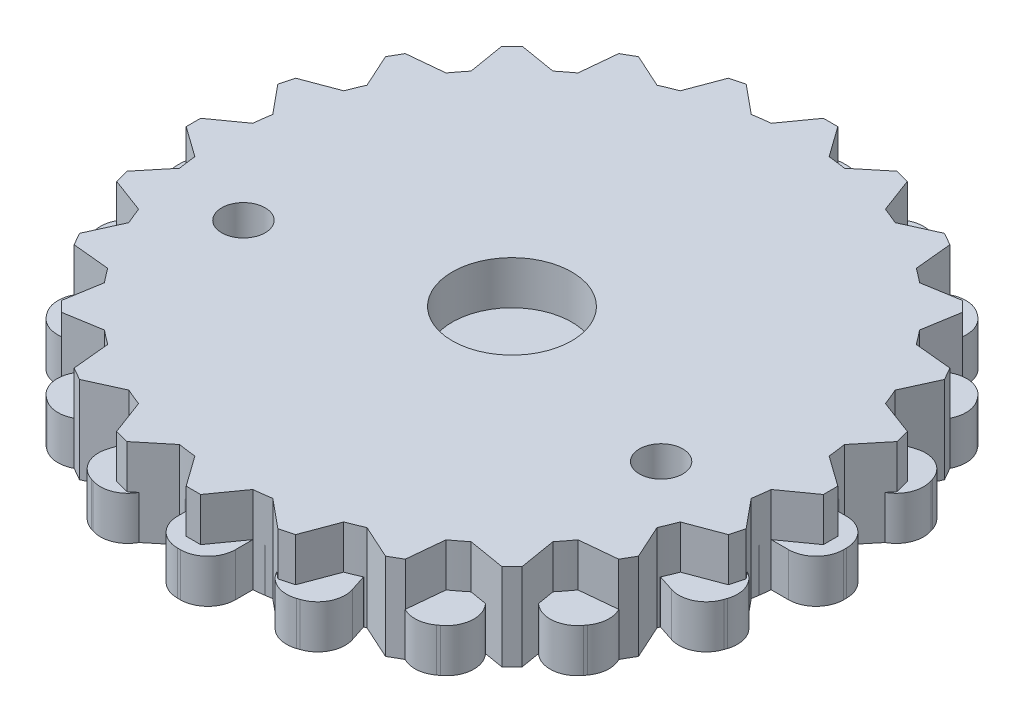
from build123d import *

# Parameters (mm, degrees)
BOSS_EXTRUDE3_DEPTH = 3
BOSS_EXTRUDE5_DEPTH = 6
BOSS_EXTRUDE6_DEPTH = 3
SKETCH4_R           = 4.125
CUT_EXTRUDE1_DEPTH  = 10
SKETCH5_R           = 1.5
CUT_EXTRUDE2_DEPTH  = 34.075670817


with BuildPart() as part:
    # Sketch2 → Boss-Extrude3 (new body)
    with BuildSketch(Plane(origin=(0, 0, 0), x_dir=(1, 0, 0), z_dir=(0, 1, 0))):
        with BuildLine():
            Line((-23, 0.1), (-23, -0.1))
            ThreePointArc((-23, -0.1), (-22.443502884, -1.443502884), (-21.1, -2))
            Line((-21.1, -2), (-19.899748742, -2))
            ThreePointArc((-19.899748742, -2), (-19.753766812, -3.128689301), (-19.543819703, -4.247247513))
            Line((-19.543819703, -4.247247513), (-20.685326483, -4.618145549))
            ThreePointArc((-20.685326483, -4.618145549), (-21.791106589, -5.56257098), (-21.905201574, -7.012285219))
            Line((-21.905201574, -7.012285219), (-21.843398175, -7.202496522))
            ThreePointArc((-21.843398175, -7.202496522), (-20.898972744, -8.308276629), (-19.449258505, -8.422371614))
            Line((-19.449258505, -8.422371614), (-18.307751725, -8.051473578))
            ThreePointArc((-18.307751725, -8.051473578), (-17.820130484, -9.079809995), (-17.274805421, -10.078744846))
            Line((-17.274805421, -10.078744846), (-18.245829086, -10.784234835))
            ThreePointArc((-18.245829086, -10.784234835), (-19.005644954, -12.02414164), (-18.666169396, -13.438159103))
            Line((-18.666169396, -13.438159103), (-18.548612345, -13.599962502))
            ThreePointArc((-18.548612345, -13.599962502), (-17.30870554, -14.35977837), (-15.894688077, -14.020302812))
            Line((-15.894688077, -14.020302812), (-14.923664412, -13.314812824))
            ThreePointArc((-14.923664412, -13.314812824), (-14.142135624, -14.142135624), (-13.314812824, -14.923664412))
            Line((-13.314812824, -14.923664412), (-14.020302812, -15.894688077))
            ThreePointArc((-14.020302812, -15.894688077), (-14.35977837, -17.30870554), (-13.599962502, -18.548612345))
            Line((-13.599962502, -18.548612345), (-13.438159103, -18.666169396))
            ThreePointArc((-13.438159103, -18.666169396), (-12.02414164, -19.005644954), (-10.784234835, -18.245829086))
            Line((-10.784234835, -18.245829086), (-10.078744846, -17.274805421))
            ThreePointArc((-10.078744846, -17.274805421), (-9.079809995, -17.820130484), (-8.051473578, -18.307751725))
            Line((-8.051473578, -18.307751725), (-8.422371614, -19.449258505))
            ThreePointArc((-8.422371614, -19.449258505), (-8.308276629, -20.898972744), (-7.202496522, -21.843398175))
            Line((-7.202496522, -21.843398175), (-7.012285219, -21.905201574))
            ThreePointArc((-7.012285219, -21.905201574), (-5.56257098, -21.791106589), (-4.618145549, -20.685326483))
            Line((-4.618145549, -20.685326483), (-4.247247513, -19.543819703))
            ThreePointArc((-4.247247513, -19.543819703), (-3.128689301, -19.753766812), (-2, -19.899748742))
            Line((-2, -19.899748742), (-2, -21.1))
            ThreePointArc((-2, -21.1), (-1.443502884, -22.443502884), (-0.1, -23))
            Line((-0.1, -23), (0.1, -23))
            ThreePointArc((0.1, -23), (1.443502884, -22.443502884), (2, -21.1))
            Line((2, -21.1), (2, -19.899748742))
            ThreePointArc((2, -19.899748742), (3.128689301, -19.753766812), (4.247247513, -19.543819703))
            Line((4.247247513, -19.543819703), (4.618145549, -20.685326483))
            ThreePointArc((4.618145549, -20.685326483), (5.56257098, -21.791106589), (7.012285219, -21.905201574))
            Line((7.012285219, -21.905201574), (7.202496522, -21.843398175))
            ThreePointArc((7.202496522, -21.843398175), (8.308276629, -20.898972744), (8.422371614, -19.449258505))
            Line((8.422371614, -19.449258505), (8.051473578, -18.307751725))
            ThreePointArc((8.051473578, -18.307751725), (9.079809995, -17.820130484), (10.078744846, -17.274805421))
            Line((10.078744846, -17.274805421), (10.784234835, -18.245829086))
            ThreePointArc((10.784234835, -18.245829086), (12.02414164, -19.005644954), (13.438159103, -18.666169396))
            Line((13.438159103, -18.666169396), (13.599962502, -18.548612345))
            ThreePointArc((13.599962502, -18.548612345), (14.35977837, -17.30870554), (14.020302812, -15.894688077))
            Line((14.020302812, -15.894688077), (13.314812824, -14.923664412))
            ThreePointArc((13.314812824, -14.923664412), (14.142135624, -14.142135624), (14.923664412, -13.314812824))
            Line((14.923664412, -13.314812824), (15.894688077, -14.020302812))
            ThreePointArc((15.894688077, -14.020302812), (17.30870554, -14.35977837), (18.548612345, -13.599962502))
            Line((18.548612345, -13.599962502), (18.666169396, -13.438159103))
            ThreePointArc((18.666169396, -13.438159103), (19.005644954, -12.02414164), (18.245829086, -10.784234835))
            Line((18.245829086, -10.784234835), (17.274805421, -10.078744846))
            ThreePointArc((17.274805421, -10.078744846), (17.820130484, -9.079809995), (18.307751725, -8.051473578))
            Line((18.307751725, -8.051473578), (19.449258505, -8.422371614))
            ThreePointArc((19.449258505, -8.422371614), (20.898972744, -8.308276629), (21.843398175, -7.202496522))
            Line((21.843398175, -7.202496522), (21.905201574, -7.012285219))
            ThreePointArc((21.905201574, -7.012285219), (21.791106589, -5.56257098), (20.685326483, -4.618145549))
            Line((20.685326483, -4.618145549), (19.543819703, -4.247247513))
            ThreePointArc((19.543819703, -4.247247513), (19.753766812, -3.128689301), (19.899748742, -2))
            Line((19.899748742, -2), (21.1, -2))
            ThreePointArc((21.1, -2), (22.443502884, -1.443502884), (23, -0.1))
            Line((23, -0.1), (23, 0.1))
            ThreePointArc((23, 0.1), (22.443502884, 1.443502884), (21.1, 2))
            Line((21.1, 2), (19.899748742, 2))
            ThreePointArc((19.899748742, 2), (19.753766812, 3.128689301), (19.543819703, 4.247247513))
            Line((19.543819703, 4.247247513), (20.685326483, 4.618145549))
            ThreePointArc((20.685326483, 4.618145549), (21.791106589, 5.56257098), (21.905201574, 7.012285219))
            Line((21.905201574, 7.012285219), (21.843398175, 7.202496522))
            ThreePointArc((21.843398175, 7.202496522), (20.898972744, 8.308276629), (19.449258505, 8.422371614))
            Line((19.449258505, 8.422371614), (18.307751725, 8.051473578))
            ThreePointArc((18.307751725, 8.051473578), (17.820130484, 9.079809995), (17.274805421, 10.078744846))
            Line((17.274805421, 10.078744846), (18.245829086, 10.784234835))
            ThreePointArc((18.245829086, 10.784234835), (19.005644954, 12.02414164), (18.666169396, 13.438159103))
            Line((18.666169396, 13.438159103), (18.548612345, 13.599962502))
            ThreePointArc((18.548612345, 13.599962502), (17.30870554, 14.35977837), (15.894688077, 14.020302812))
            Line((15.894688077, 14.020302812), (14.923664412, 13.314812824))
            ThreePointArc((14.923664412, 13.314812824), (14.142135624, 14.142135624), (13.314812824, 14.923664412))
            Line((13.314812824, 14.923664412), (14.020302812, 15.894688077))
            ThreePointArc((14.020302812, 15.894688077), (14.35977837, 17.30870554), (13.599962502, 18.548612345))
            Line((13.599962502, 18.548612345), (13.438159103, 18.666169396))
            ThreePointArc((13.438159103, 18.666169396), (12.02414164, 19.005644954), (10.784234835, 18.245829086))
            Line((10.784234835, 18.245829086), (10.078744846, 17.274805421))
            ThreePointArc((10.078744846, 17.274805421), (9.079809995, 17.820130484), (8.051473578, 18.307751725))
            Line((8.051473578, 18.307751725), (8.422371614, 19.449258505))
            ThreePointArc((8.422371614, 19.449258505), (8.308276629, 20.898972744), (7.202496522, 21.843398175))
            Line((7.202496522, 21.843398175), (7.012285219, 21.905201574))
            ThreePointArc((7.012285219, 21.905201574), (5.56257098, 21.791106589), (4.618145549, 20.685326483))
            Line((4.618145549, 20.685326483), (4.247247513, 19.543819703))
            ThreePointArc((4.247247513, 19.543819703), (3.128689301, 19.753766812), (2, 19.899748742))
            Line((2, 19.899748742), (2, 21.1))
            ThreePointArc((2, 21.1), (1.443502884, 22.443502884), (0.1, 23))
            Line((0.1, 23), (-0.1, 23))
            ThreePointArc((-0.1, 23), (-1.443502884, 22.443502884), (-2, 21.1))
            Line((-2, 21.1), (-2, 19.899748742))
            ThreePointArc((-2, 19.899748742), (-3.128689301, 19.753766812), (-4.247247513, 19.543819703))
            Line((-4.247247513, 19.543819703), (-4.618145549, 20.685326483))
            ThreePointArc((-4.618145549, 20.685326483), (-5.56257098, 21.791106589), (-7.012285219, 21.905201574))
            Line((-7.012285219, 21.905201574), (-7.202496522, 21.843398175))
            ThreePointArc((-7.202496522, 21.843398175), (-8.308276629, 20.898972744), (-8.422371614, 19.449258505))
            Line((-8.422371614, 19.449258505), (-8.051473578, 18.307751725))
            ThreePointArc((-8.051473578, 18.307751725), (-9.079809995, 17.820130484), (-10.078744846, 17.274805421))
            Line((-10.078744846, 17.274805421), (-10.784234835, 18.245829086))
            ThreePointArc((-10.784234835, 18.245829086), (-12.02414164, 19.005644954), (-13.438159103, 18.666169396))
            Line((-13.438159103, 18.666169396), (-13.599962502, 18.548612345))
            ThreePointArc((-13.599962502, 18.548612345), (-14.35977837, 17.30870554), (-14.020302812, 15.894688077))
            Line((-14.020302812, 15.894688077), (-13.314812824, 14.923664412))
            ThreePointArc((-13.314812824, 14.923664412), (-14.142135624, 14.142135624), (-14.923664412, 13.314812824))
            Line((-14.923664412, 13.314812824), (-15.894688077, 14.020302812))
            ThreePointArc((-15.894688077, 14.020302812), (-17.30870554, 14.35977837), (-18.548612345, 13.599962502))
            Line((-18.548612345, 13.599962502), (-18.666169396, 13.438159103))
            ThreePointArc((-18.666169396, 13.438159103), (-19.005644954, 12.02414164), (-18.245829086, 10.784234835))
            Line((-18.245829086, 10.784234835), (-17.274805421, 10.078744846))
            ThreePointArc((-17.274805421, 10.078744846), (-17.820130484, 9.079809995), (-18.307751725, 8.051473578))
            Line((-18.307751725, 8.051473578), (-19.449258505, 8.422371614))
            ThreePointArc((-19.449258505, 8.422371614), (-20.898972744, 8.308276629), (-21.843398175, 7.202496522))
            Line((-21.843398175, 7.202496522), (-21.905201574, 7.012285219))
            ThreePointArc((-21.905201574, 7.012285219), (-21.791106589, 5.56257098), (-20.685326483, 4.618145549))
            Line((-20.685326483, 4.618145549), (-19.543819703, 4.247247513))
            ThreePointArc((-19.543819703, 4.247247513), (-19.753766812, 3.128689301), (-19.899748742, 2))
            Line((-19.899748742, 2), (-21.1, 2))
            ThreePointArc((-21.1, 2), (-22.443502884, 1.443502884), (-23, 0.1))
        make_face()
    extrude(amount=BOSS_EXTRUDE3_DEPTH)


with BuildPart() as body_2:
    # Sketch3 → Boss-Extrude5 (new body)
    with BuildSketch(Plane(origin=(0, 0, 0), x_dir=(1, 0, 0), z_dir=(0, 1, 0))):
        with BuildLine():
            Line((-22, 0.5), (-22, -0.5))
            Line((-22, -0.5), (-19.899748742, -2))
            ThreePointArc((-19.899748742, -2), (-19.828897227, -2.610523844), (-19.739319337, -3.218582315))
            Line((-19.739319337, -3.218582315), (-21.379777701, -5.211056079))
            Line((-21.379777701, -5.211056079), (-21.120958656, -6.176981905))
            Line((-21.120958656, -6.176981905), (-18.704043156, -7.08228562))
            ThreePointArc((-18.704043156, -7.08228562), (-18.47759065, -7.653668647), (-18.23368794, -8.217823563))
            Line((-18.23368794, -8.217823563), (-19.302558883, -10.566987298))
            Line((-19.302558883, -10.566987298), (-18.802558883, -11.433012702))
            Line((-18.802558883, -11.433012702), (-16.23368794, -11.681925179))
            ThreePointArc((-16.23368794, -11.681925179), (-15.867066806, -12.17522858), (-15.485460842, -12.657033717))
            Line((-15.485460842, -12.657033717), (-15.909902577, -15.202795796))
            Line((-15.909902577, -15.202795796), (-15.202795796, -15.909902577))
            Line((-15.202795796, -15.909902577), (-12.657033717, -15.485460842))
            ThreePointArc((-12.657033717, -15.485460842), (-12.17522858, -15.867066806), (-11.681925179, -16.23368794))
            Line((-11.681925179, -16.23368794), (-11.433012702, -18.802558883))
            Line((-11.433012702, -18.802558883), (-10.566987298, -19.302558883))
            Line((-10.566987298, -19.302558883), (-8.217823563, -18.23368794))
            ThreePointArc((-8.217823563, -18.23368794), (-7.653668647, -18.47759065), (-7.08228562, -18.704043156))
            Line((-7.08228562, -18.704043156), (-6.176981905, -21.120958656))
            Line((-6.176981905, -21.120958656), (-5.211056079, -21.379777701))
            Line((-5.211056079, -21.379777701), (-3.218582315, -19.739319337))
            ThreePointArc((-3.218582315, -19.739319337), (-2.610523844, -19.828897227), (-2, -19.899748742))
            Line((-2, -19.899748742), (-0.5, -22))
            Line((-0.5, -22), (0.5, -22))
            Line((0.5, -22), (2, -19.899748742))
            ThreePointArc((2, -19.899748742), (2.610523844, -19.828897227), (3.218582315, -19.739319337))
            Line((3.218582315, -19.739319337), (5.211056079, -21.379777701))
            Line((5.211056079, -21.379777701), (6.176981905, -21.120958656))
            Line((6.176981905, -21.120958656), (7.08228562, -18.704043156))
            ThreePointArc((7.08228562, -18.704043156), (7.653668647, -18.47759065), (8.217823563, -18.23368794))
            Line((8.217823563, -18.23368794), (10.566987298, -19.302558883))
            Line((10.566987298, -19.302558883), (11.433012702, -18.802558883))
            Line((11.433012702, -18.802558883), (11.681925179, -16.23368794))
            ThreePointArc((11.681925179, -16.23368794), (12.17522858, -15.867066806), (12.657033717, -15.485460842))
            Line((12.657033717, -15.485460842), (15.202795796, -15.909902577))
            Line((15.202795796, -15.909902577), (15.909902577, -15.202795796))
            Line((15.909902577, -15.202795796), (15.485460842, -12.657033717))
            ThreePointArc((15.485460842, -12.657033717), (15.867066806, -12.17522858), (16.23368794, -11.681925179))
            Line((16.23368794, -11.681925179), (18.802558883, -11.433012702))
            Line((18.802558883, -11.433012702), (19.302558883, -10.566987298))
            Line((19.302558883, -10.566987298), (18.23368794, -8.217823563))
            ThreePointArc((18.23368794, -8.217823563), (18.47759065, -7.653668647), (18.704043156, -7.08228562))
            Line((18.704043156, -7.08228562), (21.120958656, -6.176981905))
            Line((21.120958656, -6.176981905), (21.379777701, -5.211056079))
            Line((21.379777701, -5.211056079), (19.739319337, -3.218582315))
            ThreePointArc((19.739319337, -3.218582315), (19.828897227, -2.610523844), (19.899748742, -2))
            Line((19.899748742, -2), (22, -0.5))
            Line((22, -0.5), (22, 0.5))
            Line((22, 0.5), (19.899748742, 2))
            ThreePointArc((19.899748742, 2), (19.828897227, 2.610523844), (19.739319337, 3.218582315))
            Line((19.739319337, 3.218582315), (21.379777701, 5.211056079))
            Line((21.379777701, 5.211056079), (21.120958656, 6.176981905))
            Line((21.120958656, 6.176981905), (18.704043156, 7.08228562))
            ThreePointArc((18.704043156, 7.08228562), (18.47759065, 7.653668647), (18.23368794, 8.217823563))
            Line((18.23368794, 8.217823563), (19.302558883, 10.566987298))
            Line((19.302558883, 10.566987298), (18.802558883, 11.433012702))
            Line((18.802558883, 11.433012702), (16.23368794, 11.681925179))
            ThreePointArc((16.23368794, 11.681925179), (15.867066806, 12.17522858), (15.485460842, 12.657033717))
            Line((15.485460842, 12.657033717), (15.909902577, 15.202795796))
            Line((15.909902577, 15.202795796), (15.202795796, 15.909902577))
            Line((15.202795796, 15.909902577), (12.657033717, 15.485460842))
            ThreePointArc((12.657033717, 15.485460842), (12.17522858, 15.867066806), (11.681925179, 16.23368794))
            Line((11.681925179, 16.23368794), (11.433012702, 18.802558883))
            Line((11.433012702, 18.802558883), (10.566987298, 19.302558883))
            Line((10.566987298, 19.302558883), (8.217823563, 18.23368794))
            ThreePointArc((8.217823563, 18.23368794), (7.653668647, 18.47759065), (7.08228562, 18.704043156))
            Line((7.08228562, 18.704043156), (6.176981905, 21.120958656))
            Line((6.176981905, 21.120958656), (5.211056079, 21.379777701))
            Line((5.211056079, 21.379777701), (3.218582315, 19.739319337))
            ThreePointArc((3.218582315, 19.739319337), (2.610523844, 19.828897227), (2, 19.899748742))
            Line((2, 19.899748742), (0.5, 22))
            Line((0.5, 22), (-0.5, 22))
            Line((-0.5, 22), (-2, 19.899748742))
            ThreePointArc((-2, 19.899748742), (-2.610523844, 19.828897227), (-3.218582315, 19.739319337))
            Line((-3.218582315, 19.739319337), (-5.211056079, 21.379777701))
            Line((-5.211056079, 21.379777701), (-6.176981905, 21.120958656))
            Line((-6.176981905, 21.120958656), (-7.08228562, 18.704043156))
            ThreePointArc((-7.08228562, 18.704043156), (-7.653668647, 18.47759065), (-8.217823563, 18.23368794))
            Line((-8.217823563, 18.23368794), (-10.566987298, 19.302558883))
            Line((-10.566987298, 19.302558883), (-11.433012702, 18.802558883))
            Line((-11.433012702, 18.802558883), (-11.681925179, 16.23368794))
            ThreePointArc((-11.681925179, 16.23368794), (-12.17522858, 15.867066806), (-12.657033717, 15.485460842))
            Line((-12.657033717, 15.485460842), (-15.202795796, 15.909902577))
            Line((-15.202795796, 15.909902577), (-15.909902577, 15.202795796))
            Line((-15.909902577, 15.202795796), (-15.485460842, 12.657033717))
            ThreePointArc((-15.485460842, 12.657033717), (-15.867066806, 12.17522858), (-16.23368794, 11.681925179))
            Line((-16.23368794, 11.681925179), (-18.802558883, 11.433012702))
            Line((-18.802558883, 11.433012702), (-19.302558883, 10.566987298))
            Line((-19.302558883, 10.566987298), (-18.23368794, 8.217823563))
            ThreePointArc((-18.23368794, 8.217823563), (-18.47759065, 7.653668647), (-18.704043156, 7.08228562))
            Line((-18.704043156, 7.08228562), (-21.120958656, 6.176981905))
            Line((-21.120958656, 6.176981905), (-21.379777701, 5.211056079))
            Line((-21.379777701, 5.211056079), (-19.739319337, 3.218582315))
            ThreePointArc((-19.739319337, 3.218582315), (-19.828897227, 2.610523844), (-19.899748742, 2))
            Line((-19.899748742, 2), (-22, 0.5))
        make_face()
    extrude(amount=BOSS_EXTRUDE5_DEPTH)

    # Sketch4 → Cut-Extrude1 (cut)
    with BuildSketch(Plane(origin=(0, 6, 0), x_dir=(1, 0, 0), z_dir=(0, 1, 0))):
        Circle(SKETCH4_R)
    extrude(amount=-CUT_EXTRUDE1_DEPTH, mode=Mode.SUBTRACT)

    # Sketch5 → Cut-Extrude2 (cut, through all)
    with BuildSketch(Plane(origin=(0, 6, 0), x_dir=(1, 0, 0), z_dir=(0, 1, 0))):
        with Locations((-14.421663392, -4.125)):
            Circle(SKETCH5_R)
        with Locations((14.421663392, -4.125)):
            Circle(SKETCH5_R)
    extrude(amount=-CUT_EXTRUDE2_DEPTH, mode=Mode.SUBTRACT)


with BuildPart() as body_3:
    # Sketch1 → Boss-Extrude6 (new body)
    with BuildSketch(Plane(origin=(0, 0, 0), x_dir=(1, 0, 0), z_dir=(0, 1, 0))):
        with BuildLine():
            Line((-0.5, 14.746169466), (0.5, 14.746169466))
            Line((0.5, 14.746169466), (2, 12.544128437))
            ThreePointArc((2, 12.544128437), (2.588190451, 12.405427729), (3.166928678, 12.23145084))
            Line((3.166928678, 12.23145084), (5.566987298, 13.388474311))
            Line((5.566987298, 13.388474311), (6.433012702, 12.888474311))
            Line((6.433012702, 12.888474311), (6.631030293, 10.23145084))
            ThreePointArc((6.631030293, 10.23145084), (7.071067812, 9.817237278), (7.485281374, 9.377199759))
            Line((7.485281374, 9.377199759), (10.142304845, 9.179182168))
            Line((10.142304845, 9.179182168), (10.642304845, 8.313156764))
            Line((10.642304845, 8.313156764), (9.485281374, 5.913098144))
            ThreePointArc((9.485281374, 5.913098144), (9.659258263, 5.334359917), (9.797958971, 4.746169466))
            Line((9.797958971, 4.746169466), (12, 3.246169466))
            Line((12, 3.246169466), (12, 2.246169466))
            Line((12, 2.246169466), (9.797958971, 0.746169466))
            ThreePointArc((9.797958971, 0.746169466), (9.659258263, 0.157979015), (9.485281374, -0.420759212))
            Line((9.485281374, -0.420759212), (10.642304845, -2.820817832))
            Line((10.642304845, -2.820817832), (10.142304845, -3.686843236))
            Line((10.142304845, -3.686843236), (7.485281374, -3.884860827))
            ThreePointArc((7.485281374, -3.884860827), (7.071067812, -4.324898346), (6.631030293, -4.739111908))
            Line((6.631030293, -4.739111908), (6.433012702, -7.39613538))
            Line((6.433012702, -7.39613538), (5.566987298, -7.89613538))
            Line((5.566987298, -7.89613538), (3.166928678, -6.739111908))
            ThreePointArc((3.166928678, -6.739111908), (2.588190451, -6.913088797), (2, -7.051789505))
            Line((2, -7.051789505), (0.5, -9.253830534))
            Line((0.5, -9.253830534), (-0.5, -9.253830534))
            Line((-0.5, -9.253830534), (-2, -7.051789505))
            ThreePointArc((-2, -7.051789505), (-2.588190451, -6.913088797), (-3.166928678, -6.739111908))
            Line((-3.166928678, -6.739111908), (-5.566987298, -7.89613538))
            Line((-5.566987298, -7.89613538), (-6.433012702, -7.39613538))
            Line((-6.433012702, -7.39613538), (-6.631030293, -4.739111908))
            ThreePointArc((-6.631030293, -4.739111908), (-7.071067812, -4.324898346), (-7.485281374, -3.884860827))
            Line((-7.485281374, -3.884860827), (-10.142304845, -3.686843236))
            Line((-10.142304845, -3.686843236), (-10.642304845, -2.820817832))
            Line((-10.642304845, -2.820817832), (-9.485281374, -0.420759212))
            ThreePointArc((-9.485281374, -0.420759212), (-9.659258263, 0.157979015), (-9.797958971, 0.746169466))
            Line((-9.797958971, 0.746169466), (-12, 2.246169466))
            Line((-12, 2.246169466), (-12, 3.246169466))
            Line((-12, 3.246169466), (-9.797958971, 4.746169466))
            ThreePointArc((-9.797958971, 4.746169466), (-9.659258263, 5.334359917), (-9.485281374, 5.913098144))
            Line((-9.485281374, 5.913098144), (-10.642304845, 8.313156764))
            Line((-10.642304845, 8.313156764), (-10.142304845, 9.179182168))
            Line((-10.142304845, 9.179182168), (-7.485281374, 9.377199759))
            ThreePointArc((-7.485281374, 9.377199759), (-7.071067812, 9.817237278), (-6.631030293, 10.23145084))
            Line((-6.631030293, 10.23145084), (-6.433012702, 12.888474311))
            Line((-6.433012702, 12.888474311), (-5.566987298, 13.388474311))
            Line((-5.566987298, 13.388474311), (-3.166928678, 12.23145084))
            ThreePointArc((-3.166928678, 12.23145084), (-2.588190451, 12.405427729), (-2, 12.544128437))
            Line((-2, 12.544128437), (-0.5, 14.746169466))
        make_face()
    extrude(amount=BOSS_EXTRUDE6_DEPTH)


solid = Compound([part.part, body_2.part, body_3.part])
